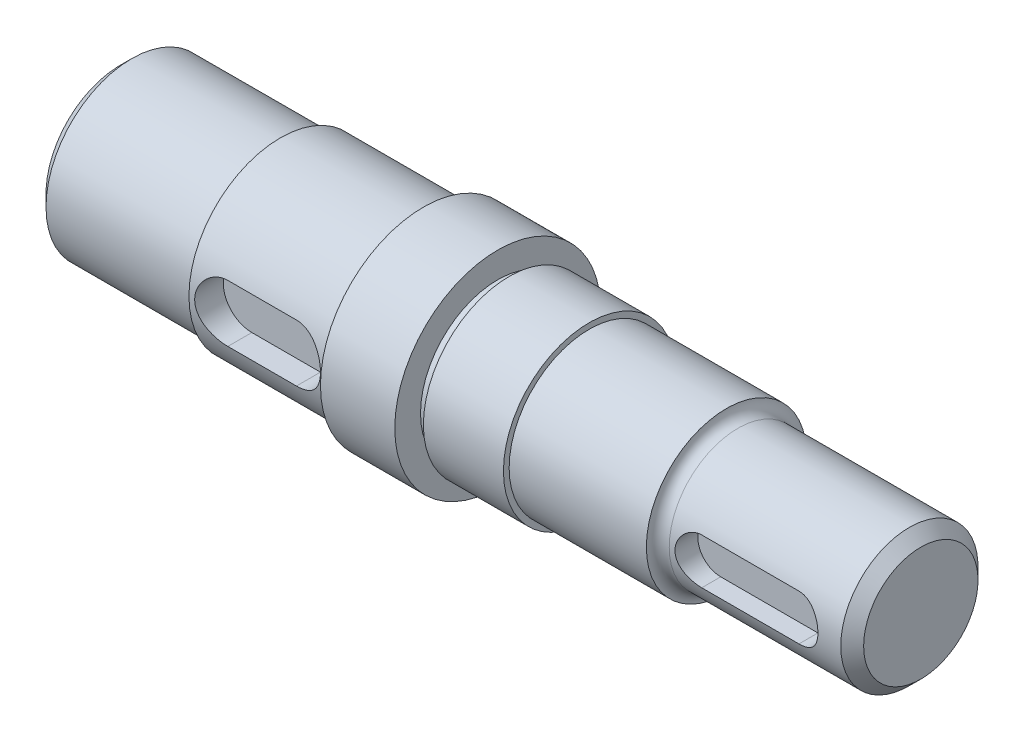
from build123d import *

# Parameters (mm, degrees)
CUT_EXTRUDE_1_DEPTH = 12
CUT_EXTRUDE_2_DEPTH = 9
CHAMFER_1_SIZE      = 2
FILLET_1_R          = 2


with BuildPart() as part:
    # 草图1 → 旋转1 (revolve)
    with BuildSketch(Plane.XY, mode=Mode.PRIVATE) as revolve_1_sk:
        Polygon((0, 0), (0, 15), (28, 15), (28, 16), (53, 16), (53, 18), (66, 18), (66, 13.5), (68, 13.5), (68, 15), (82, 15), (82, 14), (106, 14), (106, 12), (140, 12), (140, 0), align=None)
    revolve(revolve_1_sk.sketch.rotate(Axis((0, 0, 0), (1, 0, 0)), 90), axis=Axis((0, 0, 0), (1, 0, 0)))

    # 草图2 → 切除-拉伸1 (cut)
    with BuildSketch(Plane.XY.offset(20)):
        with BuildLine():
            Line((113, 4), (130, 4))
            ThreePointArc((130, 4), (134, 0), (130, -4))
            Line((130, -4), (113, -4))
            ThreePointArc((113, -4), (109, 0), (113, 4))
        make_face()
    extrude(amount=-CUT_EXTRUDE_1_DEPTH, mode=Mode.SUBTRACT)

    # 草图3 → 切除-拉伸2 (cut)
    with BuildSketch(Plane.XY.offset(20)):
        with BuildLine():
            Line((34, 5), (46, 5))
            ThreePointArc((46, 5), (51, 0), (46, -5))
            Line((46, -5), (34, -5))
            ThreePointArc((34, -5), (29, 0), (34, 5))
        make_face()
    extrude(amount=-CUT_EXTRUDE_2_DEPTH, mode=Mode.SUBTRACT)

    # 倒角1
    chamfer_1_edges = [part.edges().sort_by_distance(p)[0] for p in [
        (140, 0, -12),
        (0, 0, -15),
    ]]
    chamfer(chamfer_1_edges, length=CHAMFER_1_SIZE)

    # 圆角1
    fillet_1_edges = [part.edges().sort_by_distance(p)[0] for p in [
        (106, 0, -12),
    ]]
    fillet(fillet_1_edges, radius=FILLET_1_R - 0.0001)  # a hair under: the kernel refuses the full size


solid = part.part
